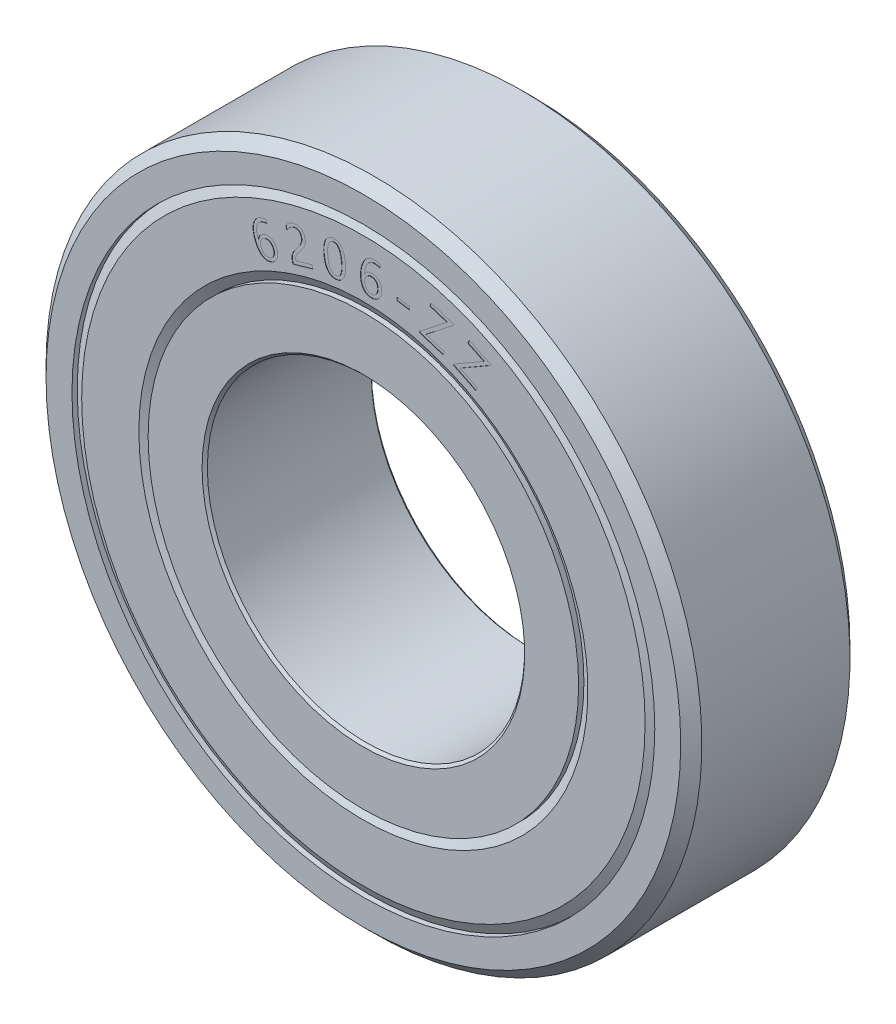
from build123d import *

# Parameters (mm, degrees)
WRAP1_START = -0.03125
WRAP1_DEPTH = 0.03125


# Read off the part's stored shape, not the designer's step: Wrap1
with BuildPart() as part:
    # Sketch1 → Revolve1 (revolve)
    with BuildSketch(Plane(origin=(0, 0, 0), x_dir=(0, 0, -1), z_dir=(1, 0, 0)), mode=Mode.PRIVATE) as revolve1_sk:
        Polygon((-15, 31), (-1, 31), (0, 30), (0, 27.55), (-0.5, 27.55), (0, 26.632766492), (0, 21.227178001), (-0.5, 20.35), (0, 20.35), (0, 15.25), (-0.25, 15), (-15.75, 15), (-16, 15.25), (-16, 20.35), (-15.5, 20.35), (-16, 21.227178001), (-16, 26.632766492), (-15.5, 27.55), (-16, 27.55), (-16, 30), align=None)
    revolve(revolve1_sk.sketch.rotate(Axis((0, 0, 0), (0, 0, 1)), 90), axis=Axis((0, 0, 0), (0, 0, 1)))

    # Wrap1 outline → Wrap1 (cut)
    # profile 1 of 7: a face of its own
    with BuildSketch(Plane.XY.offset(16).offset(WRAP1_START)):
        with BuildLine():
            add(Edge.make_bspline(
                [(-8.686815783, 20.117549912), (-8.722859253, 20.103195892), (-8.793303243, 20.075142142), (-8.902341071, 20.048318833), (-9.010387041, 20.035036667), (-9.117493542, 20.035487632), (-9.222631434, 20.05035074), (-9.325954759, 20.077121449), (-9.427100074, 20.117491532), (-9.526053483, 20.170719276), (-9.621873439, 20.236917247), (-9.714649586, 20.315724897), (-9.80465117, 20.406360164), (-9.890735386, 20.510296734), (-9.973382333, 20.625349673), (-10.050928825, 20.752581484), (-10.125874325, 20.889797402), (-10.169658996, 20.987351786), (-10.192068662, 21.037281614)],
                knots=[0, 0, 0, 0, 0.058625041, 0.114577812, 0.16927673, 0.222921005, 0.276072403, 0.32947385, 0.383986326, 0.440378705, 0.49907483, 0.5597953, 0.624256027, 0.69201223, 0.763706148, 0.838325487, 0.917252507, 1, 1, 1, 1], degree=3))
            add(Edge.make_bspline(
                [(-8.197249583, 21.482460479), (-8.182814772, 21.447469043), (-8.154474675, 21.378769792), (-8.124963946, 21.27265893), (-8.104053798, 21.167753573), (-8.095128489, 21.063350256), (-8.096006759, 20.961366535), (-8.104681526, 20.861836927), (-8.123812758, 20.765641411), (-8.152044208, 20.67283335), (-8.188253424, 20.583689078), (-8.234707833, 20.499496294), (-8.289418685, 20.419561321), (-8.35375917, 20.345389982), (-8.425272037, 20.276393507), (-8.505666518, 20.215845453), (-8.592679359, 20.161629725), (-8.655153947, 20.132375712), (-8.686815783, 20.117549912)],
                knots=[0, 0, 0, 0, 0.069936499, 0.13730746, 0.203276133, 0.267497732, 0.330668393, 0.391684228, 0.451970044, 0.511666229, 0.570843551, 0.629542941, 0.689140061, 0.749626942, 0.810812346, 0.872535145, 0.935401393, 1, 1, 1, 1], degree=3))
            add(Edge.make_bspline(
                [(-9.41398478, 22.01445575), (-9.38265969, 22.027264022), (-9.321603963, 22.052228623), (-9.227953703, 22.078517944), (-9.135599299, 22.094313007), (-9.044600249, 22.100079537), (-8.955272311, 22.09722025), (-8.868515037, 22.08374945), (-8.783987479, 22.062547391), (-8.702931612, 22.030495556), (-8.624468912, 21.991151698), (-8.550465264, 21.94193132), (-8.479256837, 21.885837175), (-8.41322184, 21.820250398), (-8.35058673, 21.747415808), (-8.293474439, 21.666501183), (-8.241383758, 21.577873998), (-8.212169109, 21.51471495), (-8.197249583, 21.482460479)],
                knots=[0, 0, 0, 0, 0.06789377, 0.132331738, 0.194804894, 0.255645807, 0.315089351, 0.373835547, 0.431572813, 0.489651074, 0.548449209, 0.607448177, 0.667750483, 0.730142659, 0.793958827, 0.86037386, 0.92869482, 1, 1, 1, 1], degree=3))
            add(Edge.make_bspline(
                [(-9.916606079, 21.366270101), (-9.912045259, 21.402609501), (-9.903113933, 21.473771912), (-9.87131608, 21.575060102), (-9.828298684, 21.668992957), (-9.771329205, 21.754693296), (-9.701331602, 21.832729558), (-9.617241393, 21.901571264), (-9.521665689, 21.964685496), (-9.450601051, 21.997531663), (-9.41398478, 22.01445575)],
                knots=[0, 0, 0, 0, 0.126822422, 0.248352732, 0.366544017, 0.484194201, 0.603918014, 0.728777904, 0.860251991, 1, 1, 1, 1], degree=3))
            Line((-9.916606079, 21.366270101), (-9.925091894, 21.362353571))
            add(Edge.make_bspline(
                [(-9.606547486, 22.944631532), (-9.637658803, 22.929971647), (-9.698886835, 22.901120543), (-9.782022458, 22.844896358), (-9.856190666, 22.780438308), (-9.920060125, 22.706985215), (-9.974778604, 22.626148933), (-10.018933176, 22.538125826), (-10.054521194, 22.443882253), (-10.080600753, 22.343480631), (-10.095991004, 22.236888903), (-10.101710316, 22.125025736), (-10.097446228, 22.007589072), (-10.083802216, 21.88512279), (-10.059334292, 21.758665835), (-10.02501889, 21.628745783), (-9.980942, 21.495569991), (-9.943969085, 21.407380376), (-9.925091894, 21.362353571)],
                knots=[0, 0, 0, 0, 0.057119755, 0.11241344, 0.166260519, 0.220107598, 0.273796414, 0.328166104, 0.383472809, 0.441042306, 0.500297207, 0.562254393, 0.627056894, 0.695502473, 0.76696116, 0.841031333, 0.91883567, 1, 1, 1, 1], degree=3))
            add(Edge.make_bspline(
                [(-9.083690783, 23.034711713), (-9.128989335, 23.036360887), (-9.218778327, 23.039629815), (-9.351904134, 23.023172447), (-9.482345795, 22.994163664), (-9.564921156, 22.961232279), (-9.606547486, 22.944631532)],
                knots=[0, 0, 0, 0, 0.253592012, 0.502660037, 0.749290378, 1, 1, 1, 1], degree=3))
            Line((-9.083690783, 23.034711713), (-9.220116565, 23.348034081))
            add(Edge.make_bspline(
                [(-9.737098473, 23.222052379), (-9.712588352, 23.232464798), (-9.665013108, 23.252675771), (-9.594122018, 23.27917572), (-9.525463719, 23.300284479), (-9.459725925, 23.319051272), (-9.396288939, 23.332854956), (-9.335217444, 23.341938466), (-9.276794742, 23.347475988), (-9.238622491, 23.347851859), (-9.220116565, 23.348034081)],
                knots=[0, 0, 0, 0, 0.149049533, 0.289311835, 0.423355869, 0.551000849, 0.671871767, 0.786410566, 0.896451737, 1, 1, 1, 1], degree=3))
            add(Edge.make_bspline(
                [(-10.192068662, 21.037281614), (-10.21793268, 21.099191903), (-10.268551991, 21.220358545), (-10.32866129, 21.4036111), (-10.376803532, 21.582069301), (-10.40835121, 21.756376293), (-10.427402089, 21.924981836), (-10.431130458, 22.087018372), (-10.422531467, 22.241932468), (-10.399798993, 22.389348308), (-10.363521043, 22.528590933), (-10.313491732, 22.659016381), (-10.250772952, 22.780704547), (-10.17401686, 22.892695699), (-10.084496137, 22.994668726), (-9.980964194, 23.083694787), (-9.865150782, 23.161369657), (-9.780323436, 23.201568497), (-9.737098473, 23.222052379)],
                knots=[0, 0, 0, 0, 0.080647521, 0.157837891, 0.231704099, 0.30272489, 0.370620794, 0.435523077, 0.497375405, 0.556949247, 0.61456941, 0.670056373, 0.724585825, 0.778793611, 0.832915465, 0.887258822, 0.942551153, 1, 1, 1, 1], degree=3))
        make_face()
        with BuildLine():
            add(Edge.make_bspline(
                [(-9.36633367, 21.701786137), (-9.386359326, 21.692417938), (-9.425705507, 21.674011409), (-9.480160881, 21.639462231), (-9.530303183, 21.600888479), (-9.575256578, 21.557147313), (-9.614617436, 21.509445932), (-9.650054055, 21.459747964), (-9.678384839, 21.406285343), (-9.702862752, 21.351082946), (-9.721092458, 21.293485969), (-9.733438754, 21.23419742), (-9.740732361, 21.173699926), (-9.74197743, 21.112050891), (-9.737397725, 21.050202246), (-9.727024979, 20.988488017), (-9.709996881, 20.927493903), (-9.694171849, 20.888102387), (-9.686183588, 20.868218086)],
                knots=[0, 0, 0, 0, 0.066694962, 0.1310415, 0.194251108, 0.257436812, 0.319935694, 0.38080777, 0.441367059, 0.502271034, 0.562940694, 0.623371559, 0.684896011, 0.746665513, 0.809247212, 0.871890951, 0.935332296, 1, 1, 1, 1], degree=3))
            add(Edge.make_bspline(
                [(-8.51840501, 21.292508793), (-8.5296007, 21.3170435), (-8.551354064, 21.36471474), (-8.588931372, 21.432042197), (-8.629793445, 21.493138852), (-8.673736117, 21.548343549), (-8.720212962, 21.597514151), (-8.768843529, 21.640788122), (-8.820486027, 21.677013213), (-8.873960489, 21.707233972), (-8.929806854, 21.73083394), (-8.987539229, 21.748158542), (-9.047440885, 21.757678689), (-9.108951541, 21.761185101), (-9.171946366, 21.75682767), (-9.236358722, 21.746570867), (-9.301766679, 21.728162416), (-9.344514273, 21.710699585), (-9.36633367, 21.701786137)],
                knots=[0, 0, 0, 0, 0.075921985, 0.14751736, 0.216853669, 0.282690345, 0.345971109, 0.407186124, 0.465665977, 0.523275869, 0.579836756, 0.636061433, 0.692572514, 0.750250794, 0.80918789, 0.870030717, 0.933660562, 1, 1, 1, 1], degree=3))
            add(Edge.make_bspline(
                [(-8.795825857, 20.406067593), (-8.775560354, 20.415394951), (-8.735641396, 20.433767967), (-8.681087075, 20.468787022), (-8.631193841, 20.507425206), (-8.587619402, 20.551474758), (-8.549003066, 20.599063528), (-8.516164747, 20.649980863), (-8.489992805, 20.704302907), (-8.468973646, 20.761078452), (-8.453969464, 20.820830287), (-8.444905871, 20.882936565), (-8.441678896, 20.947408925), (-8.444475717, 21.014006585), (-8.45276162, 21.082434148), (-8.468161234, 21.152026534), (-8.489476269, 21.222659195), (-8.5086442, 21.268940929), (-8.51840501, 21.292508793)],
                knots=[0, 0, 0, 0, 0.064137033, 0.126337031, 0.186096352, 0.245434177, 0.304214204, 0.362235401, 0.419371141, 0.477422746, 0.536202773, 0.596338261, 0.657789751, 0.721715479, 0.787972893, 0.855899167, 0.926620104, 1, 1, 1, 1], degree=3))
            add(Edge.make_bspline(
                [(-9.686183588, 20.868218086), (-9.675036646, 20.843871081), (-9.653132691, 20.796028745), (-9.613970828, 20.728320193), (-9.571284604, 20.664853471), (-9.523406352, 20.606932785), (-9.472646905, 20.554031168), (-9.419267315, 20.506890409), (-9.363087114, 20.46622069), (-9.305453816, 20.430601405), (-9.245035442, 20.402664249), (-9.183229139, 20.380816862), (-9.120009196, 20.365722668), (-9.055434728, 20.357926796), (-8.990101375, 20.356875775), (-8.924630606, 20.365155361), (-8.859111454, 20.380520524), (-8.817178356, 20.397448037), (-8.795825857, 20.406067593)],
                knots=[0, 0, 0, 0, 0.071810448, 0.141108922, 0.209603514, 0.276804573, 0.342453494, 0.406160557, 0.467582333, 0.528357017, 0.587644182, 0.645805392, 0.70400468, 0.761644941, 0.820028409, 0.878827795, 0.938298637, 1, 1, 1, 1], degree=3))
        make_face(mode=Mode.SUBTRACT)
    # profile 2 of 7: a face of its own
    with BuildSketch(Plane.XY.offset(16).offset(WRAP1_START)):
        with BuildLine():
            add(Edge.make_bspline(
                [(0.707680968, 21.901129933), (0.669042669, 21.903137915), (0.593316991, 21.907073279), (0.483804794, 21.930514225), (0.380056427, 21.963115662), (0.283713007, 22.010090335), (0.194582083, 22.06839335), (0.113051858, 22.13789865), (0.038257743, 22.217070291), (-0.028698729, 22.307359166), (-0.087302221, 22.408167188), (-0.137475825, 22.51922493), (-0.179727656, 22.639844993), (-0.214524532, 22.770026352), (-0.239336419, 22.909832536), (-0.256302485, 23.058057614), (-0.264093564, 23.214612925), (-0.262485121, 23.321520458), (-0.261660109, 23.376356085)],
                knots=[0, 0, 0, 0, 0.058389355, 0.114434994, 0.168721187, 0.222406407, 0.275856428, 0.32929026, 0.383960576, 0.440129574, 0.4987878, 0.559861289, 0.624035465, 0.691759102, 0.763293468, 0.838431909, 0.917127566, 1, 1, 1, 1], degree=3))
            add(Edge.make_bspline(
                [(1.73315897, 22.9285662), (1.731317501, 22.890629486), (1.727700362, 22.816111551), (1.709217137, 22.707456812), (1.683600927, 22.603415751), (1.647558598, 22.505206699), (1.603583706, 22.413063743), (1.553417837, 22.326708001), (1.495107545, 22.247774057), (1.430209561, 22.175612626), (1.359092525, 22.110554811), (1.280809715, 22.054373304), (1.196833235, 22.005878222), (1.107340143, 21.965201977), (1.012779084, 21.934067417), (0.914202376, 21.912222984), (0.811949494, 21.901189608), (0.742734971, 21.901149995), (0.707680968, 21.901129933)],
                knots=[0, 0, 0, 0, 0.070070298, 0.137636957, 0.203115814, 0.2676787, 0.330395244, 0.391442525, 0.451787784, 0.511242502, 0.570399214, 0.629385156, 0.688784197, 0.749197621, 0.810560032, 0.872263436, 0.93530725, 1, 1, 1, 1], degree=3))
            add(Edge.make_bspline(
                [(0.859120113, 23.928586759), (0.892694849, 23.926878689), (0.958695752, 23.92352098), (1.054479383, 23.90692302), (1.144998179, 23.881971036), (1.229923053, 23.848763048), (1.309208798, 23.807388775), (1.382697097, 23.75907912), (1.449706708, 23.703248161), (1.509949466, 23.64025254), (1.563454234, 23.570709533), (1.610890351, 23.49561163), (1.650013871, 23.41367974), (1.682511893, 23.326297698), (1.708133672, 23.233764829), (1.724845765, 23.136035282), (1.734379575, 23.033852062), (1.733570364, 22.964051902), (1.73315897, 22.9285662)],
                knots=[0, 0, 0, 0, 0.067410169, 0.13251428, 0.194589033, 0.255560699, 0.315123183, 0.373733896, 0.431705252, 0.489760401, 0.548273457, 0.607513411, 0.667658746, 0.730105515, 0.79440083, 0.860009553, 0.928830258, 1, 1, 1, 1], degree=3))
            add(Edge.make_bspline(
                [(0.126729077, 23.555863692), (0.146566339, 23.586722802), (0.185259214, 23.646913954), (0.256598664, 23.725609145), (0.335807691, 23.792243176), (0.424207077, 23.845563944), (0.521149352, 23.885594408), (0.626182748, 23.91370664), (0.740091471, 23.928742576), (0.818607648, 23.928639793), (0.859120113, 23.928586759)],
                knots=[0, 0, 0, 0, 0.126868955, 0.247459778, 0.366228683, 0.484218121, 0.603452259, 0.728297714, 0.859808133, 1, 1, 1, 1], degree=3))
            Line((0.126729077, 23.555863692), (0.117590507, 23.556516447))
            add(Edge.make_bspline(
                [(1.08105679, 24.853540501), (1.046619704, 24.853327651), (0.978908288, 24.852909138), (0.87958819, 24.837250734), (0.784748564, 24.810890107), (0.695703436, 24.770905318), (0.611837001, 24.721428015), (0.534018255, 24.6608926), (0.461490584, 24.591149012), (0.39530933, 24.510887806), (0.336191689, 24.421105397), (0.282878028, 24.322478008), (0.236898329, 24.214391409), (0.19702328, 24.09776186), (0.165450549, 23.97257542), (0.140562519, 23.840312734), (0.124218283, 23.700701101), (0.119832794, 23.605296498), (0.117590507, 23.556516447)],
                knots=[0, 0, 0, 0, 0.057153846, 0.112377914, 0.166510623, 0.220254359, 0.274075872, 0.327952004, 0.383694398, 0.440957922, 0.500421996, 0.56205684, 0.62700152, 0.695374093, 0.766666835, 0.841336777, 0.91887603, 1, 1, 1, 1], degree=3))
            add(Edge.make_bspline(
                [(1.592163904, 24.71189268), (1.551940073, 24.732555796), (1.472181966, 24.7735278), (1.344975137, 24.815654217), (1.214676731, 24.845543132), (1.125826894, 24.850860938), (1.08105679, 24.853540501)],
                knots=[0, 0, 0, 0, 0.253114679, 0.501890232, 0.749009943, 1, 1, 1, 1], degree=3))
            Line((1.592163904, 24.71189268), (1.602607983, 25.053283511))
            add(Edge.make_bspline(
                [(1.08105679, 25.159682565), (1.107614517, 25.158589432), (1.159270301, 25.156463247), (1.234829849, 25.149809319), (1.306261353, 25.14077106), (1.373729722, 25.129446236), (1.436666264, 25.113803495), (1.496057432, 25.097531984), (1.551190532, 25.077179657), (1.585734943, 25.061125218), (1.602607983, 25.053283511)],
                knots=[0, 0, 0, 0, 0.148703102, 0.289233159, 0.424228116, 0.551521341, 0.671699774, 0.786916864, 0.895920644, 1, 1, 1, 1], degree=3))
            add(Edge.make_bspline(
                [(-0.261660109, 23.376356085), (-0.258515414, 23.443425865), (-0.25236423, 23.574617768), (-0.230343463, 23.766175341), (-0.196292104, 23.947817131), (-0.15160386, 24.11937121), (-0.096329089, 24.279754808), (-0.031714794, 24.428450391), (0.042855691, 24.56437758), (0.125603315, 24.688613161), (0.217667151, 24.79919183), (0.318207671, 24.896189142), (0.427325006, 24.978983713), (0.5442674, 25.047990243), (0.669373931, 25.101191993), (0.800883961, 25.138447443), (0.939156455, 25.159393198), (1.033118077, 25.159584807), (1.08105679, 25.159682565)],
                knots=[0, 0, 0, 0, 0.080677799, 0.157809879, 0.231509189, 0.302609793, 0.370669291, 0.435188578, 0.497213011, 0.556756917, 0.614310713, 0.669793215, 0.72428962, 0.77855592, 0.832566452, 0.887199453, 0.942449769, 1, 1, 1, 1], degree=3))
        make_face()
        with BuildLine():
            add(Edge.make_bspline(
                [(0.768387177, 23.625055715), (0.746399512, 23.625010818), (0.702947513, 23.624922093), (0.638684197, 23.618006817), (0.576971492, 23.603089397), (0.517508977, 23.583256789), (0.461775932, 23.556728429), (0.40852988, 23.526854035), (0.36005899, 23.490669135), (0.314576601, 23.45077217), (0.273571096, 23.40664654), (0.237552303, 23.358080927), (0.204517408, 23.306866648), (0.177375154, 23.251299257), (0.15540482, 23.193322302), (0.137790422, 23.13346698), (0.127616185, 23.071181561), (0.124858318, 23.02890414), (0.123465302, 23.007549547)],
                knots=[0, 0, 0, 0, 0.066393817, 0.131207386, 0.194657015, 0.257840578, 0.320177571, 0.38082871, 0.441955161, 0.502485104, 0.563409824, 0.623481308, 0.684928451, 0.747241187, 0.809858193, 0.872059917, 0.935376652, 1, 1, 1, 1], degree=3))
            add(Edge.make_bspline(
                [(1.361741412, 22.893317433), (1.361824473, 22.920084099), (1.3619874, 22.972587451), (1.35714076, 23.049464116), (1.345848684, 23.1223265), (1.329729122, 23.191186597), (1.308027356, 23.255414181), (1.282933903, 23.315826659), (1.251311082, 23.370356351), (1.215829611, 23.420499349), (1.176203335, 23.466098299), (1.130351807, 23.505170922), (1.080885986, 23.540202354), (1.026062396, 23.568849982), (0.967455296, 23.592260839), (0.904764796, 23.610204009), (0.83793867, 23.621180666), (0.791925209, 23.623744297), (0.768387177, 23.625055715)],
                knots=[0, 0, 0, 0, 0.075352881, 0.147806187, 0.216598188, 0.282719789, 0.346648263, 0.407299232, 0.466566966, 0.523680661, 0.5801002, 0.636115867, 0.692876933, 0.75042593, 0.80980753, 0.870309815, 0.933657417, 1, 1, 1, 1], degree=3))
            add(Edge.make_bspline(
                [(0.73313841, 22.208577507), (0.755355448, 22.208531428), (0.799073565, 22.208440755), (0.863413425, 22.216585243), (0.924990926, 22.230743158), (0.983353463, 22.251867115), (1.038235948, 22.278644446), (1.089475031, 22.31077838), (1.136737519, 22.348221521), (1.180060681, 22.390910559), (1.218960876, 22.438554368), (1.254145505, 22.490558393), (1.283857661, 22.547750459), (1.310091147, 22.609197421), (1.331677461, 22.674851105), (1.347122379, 22.744628668), (1.35775355, 22.817738163), (1.360396311, 22.867824642), (1.361741412, 22.893317433)],
                knots=[0, 0, 0, 0, 0.063863538, 0.125669034, 0.18610247, 0.245307623, 0.303820372, 0.361483109, 0.418968883, 0.476956904, 0.536109083, 0.595660709, 0.65726616, 0.721215545, 0.787730041, 0.855764831, 0.926587831, 1, 1, 1, 1], degree=3))
            add(Edge.make_bspline(
                [(0.123465302, 23.007549547), (0.123230364, 22.980770143), (0.122767336, 22.927991753), (0.129906684, 22.849941119), (0.140982507, 22.774011406), (0.159748999, 22.701067469), (0.182550692, 22.631336419), (0.212208923, 22.566406574), (0.244039346, 22.504752788), (0.282226401, 22.448496007), (0.324789805, 22.397485129), (0.371329951, 22.351253331), (0.422560495, 22.310920204), (0.477147764, 22.275168846), (0.53630158, 22.247201344), (0.59884559, 22.225933029), (0.664963471, 22.21290305), (0.71023786, 22.210030494), (0.73313841, 22.208577507)],
                knots=[0, 0, 0, 0, 0.071690568, 0.1412919, 0.209709395, 0.276995448, 0.342793415, 0.405935819, 0.467990205, 0.528447497, 0.587624209, 0.645735108, 0.703807999, 0.762009434, 0.820143711, 0.878569419, 0.938578362, 1, 1, 1, 1], degree=3))
        make_face(mode=Mode.SUBTRACT)
    # profile 3 of 7: a face of its own
    with BuildSketch(Plane.XY.offset(16).offset(WRAP1_START)):
        with BuildLine():
            add(Edge.make_bspline(
                [(-2.572297646, 21.745813176), (-2.610796657, 21.742786653), (-2.686115637, 21.736865603), (-2.797364409, 21.746218194), (-2.90362292, 21.767510526), (-3.004823896, 21.802849566), (-3.099934037, 21.852534468), (-3.18937498, 21.914159753), (-3.272045397, 21.989114764), (-3.349354829, 22.075532988), (-3.4199735, 22.174854024), (-3.483557513, 22.286510405), (-3.542075031, 22.409545364), (-3.592286088, 22.545220711), (-3.6370898, 22.692198529), (-3.67247588, 22.851289232), (-3.7041215, 23.020951818), (-3.717524014, 23.138467275), (-3.724410105, 23.198845659)],
                knots=[0, 0, 0, 0, 0.055591359, 0.108758234, 0.160309058, 0.211497889, 0.262704016, 0.314561211, 0.367649379, 0.423185844, 0.481417946, 0.542967689, 0.608211854, 0.677598235, 0.751326758, 0.829546457, 0.912422504, 1, 1, 1, 1], degree=3))
            add(Edge.make_bspline(
                [(-1.693689505, 23.489321605), (-1.687741888, 23.42561774), (-1.676167649, 23.301648114), (-1.671310788, 23.120080511), (-1.675435274, 22.948771533), (-1.689530489, 22.787805885), (-1.713411808, 22.637687855), (-1.746624696, 22.498375502), (-1.788838313, 22.370030476), (-1.840106464, 22.252513666), (-1.901338341, 22.146833702), (-1.970203791, 22.051576565), (-2.050313349, 21.969690091), (-2.13796913, 21.898452858), (-2.234743334, 21.839809669), (-2.340042833, 21.79479672), (-2.453267106, 21.762271957), (-2.532075229, 21.751374874), (-2.572297646, 21.745813176)],
                knots=[0, 0, 0, 0, 0.087585536, 0.17044407, 0.248529309, 0.32211233, 0.391516987, 0.456479845, 0.518001271, 0.576293412, 0.631687369, 0.684959197, 0.736790272, 0.78806522, 0.839262209, 0.891174565, 0.944457222, 1, 1, 1, 1], degree=3))
            add(Edge.make_bspline(
                [(-2.846454719, 24.990005199), (-2.806445318, 24.993177421), (-2.728797961, 24.999333842), (-2.614222207, 24.991834203), (-2.50644679, 24.970878127), (-2.404217062, 24.937937778), (-2.309777604, 24.889068578), (-2.220548087, 24.828880623), (-2.138569332, 24.753863264), (-2.06263159, 24.666112881), (-1.994240269, 24.564370537), (-1.931298862, 24.450246201), (-1.875604095, 24.322455407), (-1.825986686, 24.181505298), (-1.783470373, 24.027147408), (-1.746347206, 23.859857312), (-1.715548727, 23.679256925), (-1.701136165, 23.554025819), (-1.693689505, 23.489321605)],
                knots=[0, 0, 0, 0, 0.056329036, 0.109319327, 0.160697138, 0.210286926, 0.259638717, 0.30957776, 0.361087262, 0.415265123, 0.47224155, 0.53298908, 0.598137278, 0.667844842, 0.742754497, 0.822926167, 0.908509766, 1, 1, 1, 1], degree=3))
            add(Edge.make_bspline(
                [(-3.724410105, 23.198845659), (-3.73041768, 23.265383213), (-3.742064776, 23.394381897), (-3.749703824, 23.583052496), (-3.746235338, 23.760415966), (-3.734704904, 23.926880301), (-3.711627773, 24.081906662), (-3.68028576, 24.225447314), (-3.639187386, 24.357364818), (-3.588226657, 24.4771833), (-3.528649717, 24.585822893), (-3.457930174, 24.68129883), (-3.37868509, 24.76505334), (-3.289720884, 24.836206122), (-3.191519378, 24.894771183), (-3.084401488, 24.940465954), (-2.96860192, 24.973757026), (-2.887775158, 24.984508703), (-2.846454719, 24.990005199)],
                knots=[0, 0, 0, 0, 0.089294896, 0.17311914, 0.252242165, 0.326323021, 0.396000729, 0.461554359, 0.522540886, 0.580398444, 0.635343397, 0.687755128, 0.738773238, 0.789055673, 0.839533717, 0.891128059, 0.944342241, 1, 1, 1, 1], degree=3))
        make_face()
        with BuildLine():
            add(Edge.make_bspline(
                [(-2.83209411, 24.68451589), (-2.859258762, 24.680810054), (-2.912105842, 24.67360059), (-2.986983831, 24.648502103), (-3.055608953, 24.614342065), (-3.118464366, 24.570452001), (-3.17379168, 24.51497578), (-3.222852466, 24.449900664), (-3.265347583, 24.374755475), (-3.300959704, 24.289803558), (-3.331069894, 24.19526969), (-3.354280265, 24.090381987), (-3.370678846, 23.975361345), (-3.382036502, 23.85052799), (-3.385240224, 23.715616824), (-3.383091661, 23.570837569), (-3.375639966, 23.415736142), (-3.365014058, 23.309340201), (-3.359520097, 23.254329829)],
                knots=[0, 0, 0, 0, 0.048460173, 0.094276144, 0.139079573, 0.183873059, 0.229375235, 0.277232686, 0.327797928, 0.381833645, 0.440082181, 0.503274858, 0.571827387, 0.645714674, 0.725124503, 0.81067362, 0.902111729, 1, 1, 1, 1], degree=3))
            add(Edge.make_bspline(
                [(-2.056621248, 23.415560298), (-2.062744905, 23.469358116), (-2.074622389, 23.573704713), (-2.098478993, 23.724273071), (-2.124459493, 23.864333143), (-2.156185496, 23.992877452), (-2.190020221, 24.110936545), (-2.229570765, 24.21751713), (-2.271512926, 24.313842088), (-2.31765416, 24.399442788), (-2.368671937, 24.473452811), (-2.423110795, 24.537025016), (-2.481370091, 24.589946562), (-2.544002669, 24.63172255), (-2.610762322, 24.662254757), (-2.681328631, 24.681206618), (-2.755810881, 24.689328961), (-2.806200532, 24.686149639), (-2.83209411, 24.68451589)],
                knots=[0, 0, 0, 0, 0.098545731, 0.191139937, 0.277438299, 0.357744763, 0.432061694, 0.500854239, 0.564512789, 0.623179147, 0.677560643, 0.727822819, 0.775219463, 0.820366822, 0.864322339, 0.908229652, 0.952842249, 1, 1, 1, 1], degree=3))
            add(Edge.make_bspline(
                [(-2.569033872, 22.05587177), (-2.54298237, 22.059453803), (-2.492009565, 22.06646247), (-2.419401873, 22.089875648), (-2.352940897, 22.122616123), (-2.292548286, 22.165065255), (-2.23859226, 22.217386082), (-2.19082025, 22.279210247), (-2.14959896, 22.350715779), (-2.114441319, 22.43129199), (-2.085957198, 22.521524135), (-2.063370622, 22.621102947), (-2.0464326, 22.730359874), (-2.036560547, 22.849220453), (-2.031882072, 22.977529134), (-2.034375827, 23.115170048), (-2.042095678, 23.26236585), (-2.051672598, 23.363369179), (-2.056621248, 23.415560298)],
                knots=[0, 0, 0, 0, 0.048710566, 0.095307912, 0.140801117, 0.185710312, 0.231673891, 0.279717526, 0.33018932, 0.384415126, 0.442500286, 0.505463908, 0.573689088, 0.647440568, 0.726610532, 0.811793726, 0.902748789, 1, 1, 1, 1], degree=3))
            add(Edge.make_bspline(
                [(-3.359520097, 23.254329829), (-3.353605965, 23.203144711), (-3.342177106, 23.104231205), (-3.319133782, 22.961406043), (-3.292628021, 22.828944288), (-3.262290819, 22.706554624), (-3.227243322, 22.594904286), (-3.187926986, 22.4937515), (-3.145315248, 22.402524862), (-3.09753744, 22.321950005), (-3.04625827, 22.251434766), (-2.990091904, 22.192065389), (-2.930484009, 22.142173322), (-2.865900841, 22.103437366), (-2.797385447, 22.07467789), (-2.724545641, 22.058169953), (-2.647895978, 22.050339617), (-2.595798194, 22.053994261), (-2.569033872, 22.05587177)],
                knots=[0, 0, 0, 0, 0.096516094, 0.186514084, 0.270930708, 0.349525354, 0.422620362, 0.489989114, 0.55271016, 0.611011903, 0.665226205, 0.715686548, 0.763753996, 0.810380925, 0.85625344, 0.902326537, 0.949821971, 1, 1, 1, 1], degree=3))
        make_face(mode=Mode.SUBTRACT)
    # profile 4 of 7: a face of its own
    with BuildSketch(Plane.XY.offset(16).offset(WRAP1_START)):
        with BuildLine():
            add(Edge.make_bspline(
                [(-6.601340088, 24.001248637), (-6.634610472, 23.990507465), (-6.701197779, 23.969010095), (-6.793835638, 23.91845711), (-6.88117587, 23.858063427), (-6.962737117, 23.787495492), (-7.0378873, 23.707076731), (-7.107327289, 23.619346873), (-7.170705012, 23.524703409), (-7.205765317, 23.456994236), (-7.223415541, 23.422907765)],
                knots=[0, 0, 0, 0, 0.119855874, 0.239879411, 0.360747019, 0.484211769, 0.609517769, 0.738264798, 0.868236033, 1, 1, 1, 1], degree=3))
            add(Edge.make_bspline(
                [(-5.883309661, 23.607637412), (-5.890353503, 23.629954638), (-5.904089989, 23.673476377), (-5.929910882, 23.734647565), (-5.960331589, 23.789785246), (-5.994865356, 23.838705334), (-6.03305387, 23.881895412), (-6.073484914, 23.920297549), (-6.117455165, 23.952353904), (-6.164062084, 23.978539581), (-6.212769012, 23.999266696), (-6.263162413, 24.016427124), (-6.316455799, 24.025389939), (-6.371214878, 24.030996997), (-6.42758452, 24.030599747), (-6.485025346, 24.026245285), (-6.543294733, 24.016331238), (-6.581823491, 24.006319862), (-6.601340088, 24.001248637)],
                knots=[0, 0, 0, 0, 0.075759873, 0.147742445, 0.214607958, 0.279318811, 0.341229975, 0.40105291, 0.459541336, 0.51696317, 0.573772152, 0.630816621, 0.688861946, 0.74831858, 0.808916648, 0.871119838, 0.934716237, 1, 1, 1, 1], degree=3))
            add(Edge.make_bspline(
                [(-6.207728863, 22.542341359), (-6.186692099, 22.569425358), (-6.146058381, 22.621739657), (-6.089442598, 22.699597031), (-6.040142373, 22.774512705), (-5.996282062, 22.846088566), (-5.959178375, 22.915878887), (-5.925998135, 22.983127978), (-5.900132092, 23.04979799), (-5.878212756, 23.114343815), (-5.86172752, 23.178032995), (-5.850617809, 23.240665212), (-5.844539153, 23.302233257), (-5.844061742, 23.383271393), (-5.85299068, 23.486104392), (-5.873048522, 23.566505846), (-5.883309661, 23.607637412)],
                knots=[0, 0, 0, 0, 0.088400926, 0.170751464, 0.248065885, 0.319536114, 0.387040428, 0.451763508, 0.512693579, 0.571224616, 0.627408185, 0.682090682, 0.73505479, 0.786659075, 0.890859604, 1, 1, 1, 1], degree=3))
            add(Edge.make_bspline(
                [(-6.693378534, 21.112808053), (-6.701804731, 21.144485294), (-6.718207572, 21.206149738), (-6.7358847, 21.297481627), (-6.74659573, 21.384508563), (-6.750093032, 21.467918085), (-6.746141876, 21.549188943), (-6.734812316, 21.629962164), (-6.716767004, 21.710905362), (-6.690105763, 21.792027561), (-6.655509792, 21.873913137), (-6.614525427, 21.958267531), (-6.565214702, 22.044301316), (-6.508382052, 22.133104424), (-6.443578877, 22.226146827), (-6.37189483, 22.325744611), (-6.292943438, 22.43235534), (-6.236809513, 22.504807112), (-6.207728863, 22.542341359)],
                knots=[0, 0, 0, 0, 0.061980301, 0.120653841, 0.175779782, 0.227671316, 0.278347685, 0.329445027, 0.381757465, 0.434982907, 0.490695539, 0.549773198, 0.612248783, 0.678117974, 0.749118099, 0.826663046, 0.910201339, 1, 1, 1, 1], degree=3))
            Line((-6.693378534, 21.112808053), (-6.650296709, 20.962021663))
            Line((-6.650296709, 20.962021663), (-4.772320763, 21.49728071))
            Line((-4.772320763, 21.49728071), (-4.861095434, 21.809297568))
            Line((-4.861095434, 21.809297568), (-6.376139636, 21.377173802))
            add(Edge.make_bspline(
                [(-5.902892309, 22.452261178), (-5.930228801, 22.418208738), (-5.982522708, 22.353067419), (-6.055280134, 22.258018339), (-6.121593894, 22.172089427), (-6.179910099, 22.09331466), (-6.231812695, 22.021272203), (-6.275612304, 21.952834833), (-6.313695879, 21.888712543), (-6.344866274, 21.827512191), (-6.369164004, 21.768991985), (-6.388091046, 21.712636347), (-6.399489661, 21.657582699), (-6.406560345, 21.603901016), (-6.407173507, 21.549790649), (-6.401324723, 21.49420236), (-6.391957131, 21.436031087), (-6.381498332, 21.397113639), (-6.376139636, 21.377173802)],
                knots=[0, 0, 0, 0, 0.106586134, 0.203896147, 0.292171502, 0.371521177, 0.443140967, 0.508846961, 0.569786444, 0.625129514, 0.676320817, 0.724356612, 0.769983044, 0.813329944, 0.856353514, 0.901697772, 0.949633633, 1, 1, 1, 1], degree=3))
            add(Edge.make_bspline(
                [(-5.537349546, 23.738188399), (-5.529248106, 23.708708463), (-5.51340679, 23.651064269), (-5.498358187, 23.564697799), (-5.487932182, 23.481274447), (-5.484847132, 23.400064684), (-5.487404998, 23.320660786), (-5.495760422, 23.242244471), (-5.511171, 23.164718342), (-5.531387445, 23.087243912), (-5.557465115, 23.009886326), (-5.59058574, 22.933062058), (-5.62839636, 22.855419855), (-5.673080489, 22.777982968), (-5.723413749, 22.699546862), (-5.777181787, 22.618034647), (-5.838190897, 22.535743129), (-5.881031859, 22.480466946), (-5.902892309, 22.452261178)],
                knots=[0, 0, 0, 0, 0.065483489, 0.128044476, 0.187676471, 0.245544914, 0.301998286, 0.357818364, 0.414335252, 0.471226015, 0.529325082, 0.589084562, 0.650395748, 0.714306355, 0.780540948, 0.85012003, 0.923520774, 1, 1, 1, 1], degree=3))
            add(Edge.make_bspline(
                [(-6.642463649, 24.308696211), (-6.611680591, 24.316821309), (-6.551242612, 24.332773736), (-6.459926195, 24.347647542), (-6.370188949, 24.355100872), (-6.282201676, 24.354178785), (-6.196408204, 24.346995646), (-6.114130763, 24.33021225), (-6.034875074, 24.307060333), (-5.959958955, 24.274530264), (-5.888113278, 24.235894073), (-5.822168726, 24.187202138), (-5.759427712, 24.132368692), (-5.70230019, 24.068902089), (-5.650247334, 23.998076332), (-5.60515631, 23.918970045), (-5.566266715, 23.832036354), (-5.547143331, 23.769973209), (-5.537349546, 23.738188399)],
                knots=[0, 0, 0, 0, 0.068112827, 0.133729457, 0.197739725, 0.260614921, 0.321880912, 0.381706751, 0.440055045, 0.498273084, 0.55622038, 0.614259309, 0.673318867, 0.734315198, 0.796634249, 0.861102034, 0.928865263, 1, 1, 1, 1], degree=3))
            add(Edge.make_bspline(
                [(-7.329814595, 23.796283588), (-7.311483767, 23.826284302), (-7.275277872, 23.885539819), (-7.210871155, 23.966712351), (-7.141272155, 24.041491835), (-7.063682237, 24.109248017), (-6.976110382, 24.170181839), (-6.876523199, 24.224140523), (-6.76423852, 24.271251963), (-6.684048473, 24.295909398), (-6.642463649, 24.308696211)],
                knots=[0, 0, 0, 0, 0.119596323, 0.236219113, 0.352039226, 0.467022429, 0.586211989, 0.714503794, 0.851947843, 1, 1, 1, 1], degree=3))
            Line((-7.329814595, 23.796283588), (-7.223415541, 23.422907765))
        make_face()
    # profile 5 of 7: a face of its own
    with BuildSketch(Plane.XY.offset(16).offset(WRAP1_START)):
        Polygon((7.645703332, 20.945337925), (5.922430306, 21.498874109), (8.524964228, 23.541997053), (8.552379936, 23.62620244), (6.400899673, 24.31681716), (6.297764393, 23.996967242), (7.906805306, 23.479985334), (5.323854031, 21.447306469), (5.292521794, 21.348740474), (7.543220807, 20.626140762), align=None)
    # profile 6 of 7: a face of its own
    with BuildSketch(Plane.XY.offset(16).offset(WRAP1_START)):
        Polygon((10.774180087, 19.555520111), (9.15143132, 20.343395316), (12.006581403, 21.994212545), (12.045093944, 22.073195892), (10.018942628, 23.056897578), (9.872725523, 22.755977553), (11.38842248, 22.020322742), (8.553507801, 20.376033063), (8.50846771, 20.283341862), (10.627962982, 19.254600086), align=None)
    # profile 7 of 7: a face of its own
    with BuildSketch(Plane.XY.offset(16).offset(WRAP1_START)):
        Polygon((3.196608393, 23.17489352), (3.153526567, 22.893556143), (4.344804322, 22.711437516), (4.387886148, 22.992774893), align=None)
    extrude(amount=WRAP1_DEPTH, mode=Mode.SUBTRACT)


solid = part.part
